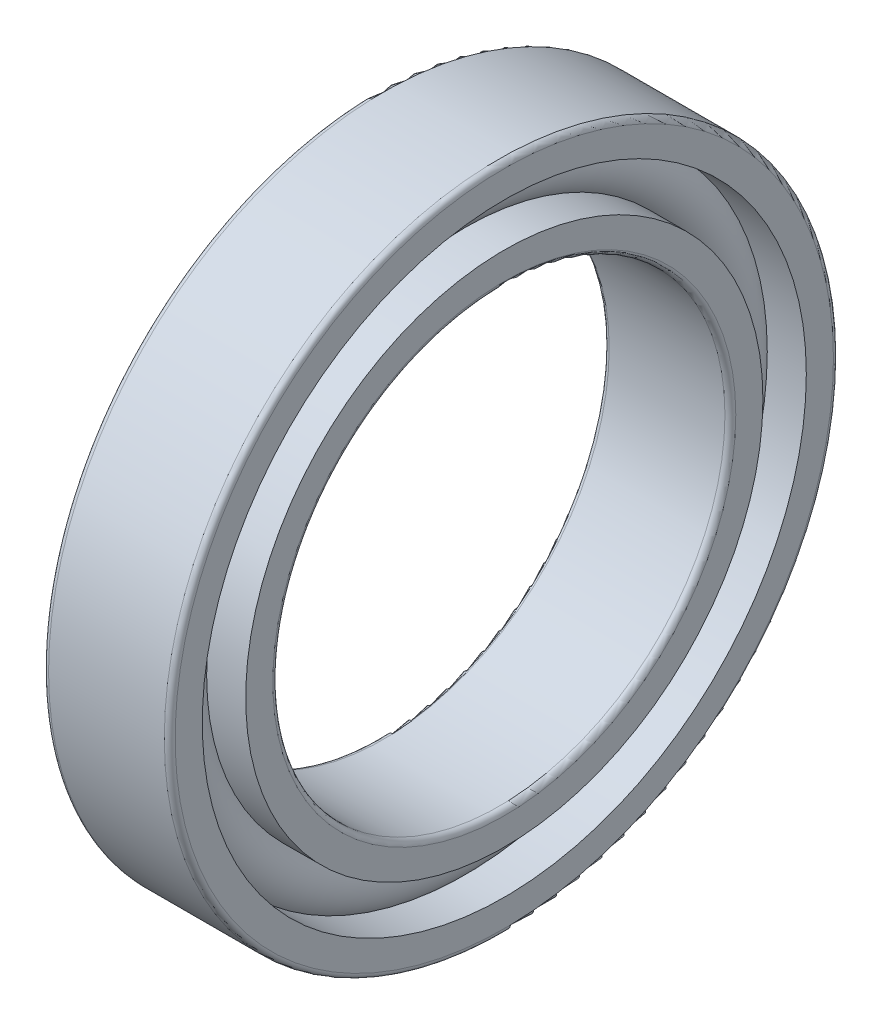
from build123d import *

# Parameters (mm, degrees)
CAGSPISKE_W     = 0.36
CAGSPISKE_H     = 0.6
CAGESPINE_ANGLE = 0.001
BALSIMSKE_R     = 1.8


with BuildPart() as part:
    # CagSpiSke → CageSpine (revolve)
    with BuildSketch(Plane.XY):
        with Locations((0, 15.5)):
            Rectangle(CAGSPISKE_W, CAGSPISKE_H)
    revolve(axis=Axis((-20.6375, 0, 0), (-1, 0, 0)), revolution_arc=CAGESPINE_ANGLE)

    # BalSimSke → BallsSimplified (revolve)
    with BuildSketch(Plane.XY):
        with Locations((0, 15.5)):
            Circle(BALSIMSKE_R)
    revolve(axis=Axis((-10, 0, 0), (1, 0, 0)))

    # InnRacSke → InnerRace (revolve)
    with BuildSketch(Plane.XY):
        with BuildLine():
            Line((-1.307908636, 14.3), (-3.5, 14.3))
            Line((-3.5, 14.3), (-3.5, 12.8))
            ThreePointArc((-3.5, 12.8), (-3.412132034, 12.587867966), (-3.2, 12.5))
            Line((-3.2, 12.5), (3.2, 12.5))
            ThreePointArc((3.2, 12.5), (3.412132034, 12.587867966), (3.5, 12.8))
            Line((3.5, 12.8), (3.5, 14.3))
            Line((3.5, 14.3), (1.307908636, 14.3))
            ThreePointArc((1.307908636, 14.3), (0, 13.725), (-1.307908636, 14.3))
        make_face()
    revolve(axis=Axis((-20.6375, 0, 0), (1, 0, 0)))

    # OutRacSke → OuterRace (revolve)
    with BuildSketch(Plane.XY):
        with BuildLine():
            Line((-1.307908636, 16.7), (-3.5, 16.7))
            Line((-3.5, 16.7), (-3.5, 18.2))
            ThreePointArc((-3.5, 18.2), (-3.412132034, 18.412132034), (-3.2, 18.5))
            Line((-3.2, 18.5), (3.2, 18.5))
            ThreePointArc((3.2, 18.5), (3.412132034, 18.412132034), (3.5, 18.2))
            Line((3.5, 18.2), (3.5, 16.7))
            Line((3.5, 16.7), (1.307908636, 16.7))
            ThreePointArc((1.307908636, 16.7), (0, 17.275), (-1.307908636, 16.7))
        make_face()
    revolve(axis=Axis((-20.6375, 0, 0), (1, 0, 0)))


solid = part.part
